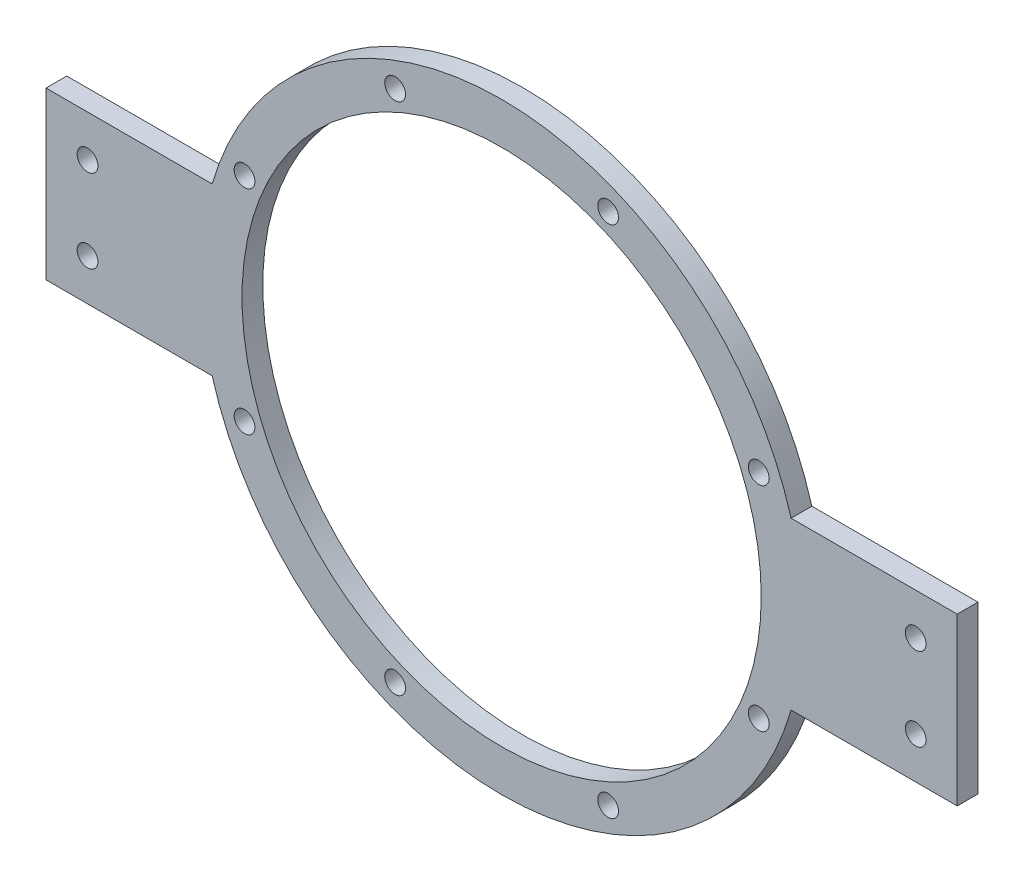
from build123d import *

# Parameters (mm, degrees)
SKETCH1_R           = 79.375
BOSS_EXTRUDE1_DEPTH = 6.35
SKETCH2_R           = 3.175
CUT_EXTRUDE1_DEPTH  = 76.2


with BuildPart() as part:
    # Sketch1 → Boss-Extrude1 (new body)
    with BuildSketch(Plane.XY):
        with BuildLine():
            Line((-139.302235141, 25.4), (-88.502235141, 25.4))
            ThreePointArc((-88.502235141, 25.4), (0, 92.075), (88.502235141, 25.4))
            Line((88.502235141, 25.4), (139.302235141, 25.4))
            Line((139.302235141, 25.4), (139.302235141, -25.4))
            Line((139.302235141, -25.4), (88.502235141, -25.4))
            ThreePointArc((88.502235141, -25.4), (0, -92.075), (-88.502235141, -25.4))
            Line((-88.502235141, -25.4), (-139.302235141, -25.4))
            Line((-139.302235141, -25.4), (-139.302235141, 25.4))
        make_face()
        Circle(SKETCH1_R, mode=Mode.SUBTRACT)
    extrude(amount=BOSS_EXTRUDE1_DEPTH)

    # Sketch2 → Cut-Extrude1 (cut)
    with BuildSketch(Plane.XY.offset(6.35)):
        with Locations((-32.56253326, 78.612909421)):
            Circle(SKETCH2_R)
        with Locations((32.56253326, 78.612909421)):
            Circle(SKETCH2_R)
        with Locations((78.612909421, 32.56253326)):
            Circle(SKETCH2_R)
        with Locations((78.612909421, -32.56253326)):
            Circle(SKETCH2_R)
        with Locations((32.56253326, -78.612909421)):
            Circle(SKETCH2_R)
        with Locations((-32.56253326, -78.612909421)):
            Circle(SKETCH2_R)
        with Locations((-78.612909421, -32.56253326)):
            Circle(SKETCH2_R)
        with Locations((-78.612909421, 32.56253326)):
            Circle(SKETCH2_R)
        with Locations((-126.602235141, 12.7)):
            Circle(SKETCH2_R)
        with Locations((-126.602235141, -12.7)):
            Circle(SKETCH2_R)
        with Locations((126.602235141, 12.7)):
            Circle(SKETCH2_R)
        with Locations((126.602235141, -12.7)):
            Circle(SKETCH2_R)
    extrude(amount=-CUT_EXTRUDE1_DEPTH, mode=Mode.SUBTRACT)


solid = part.part
